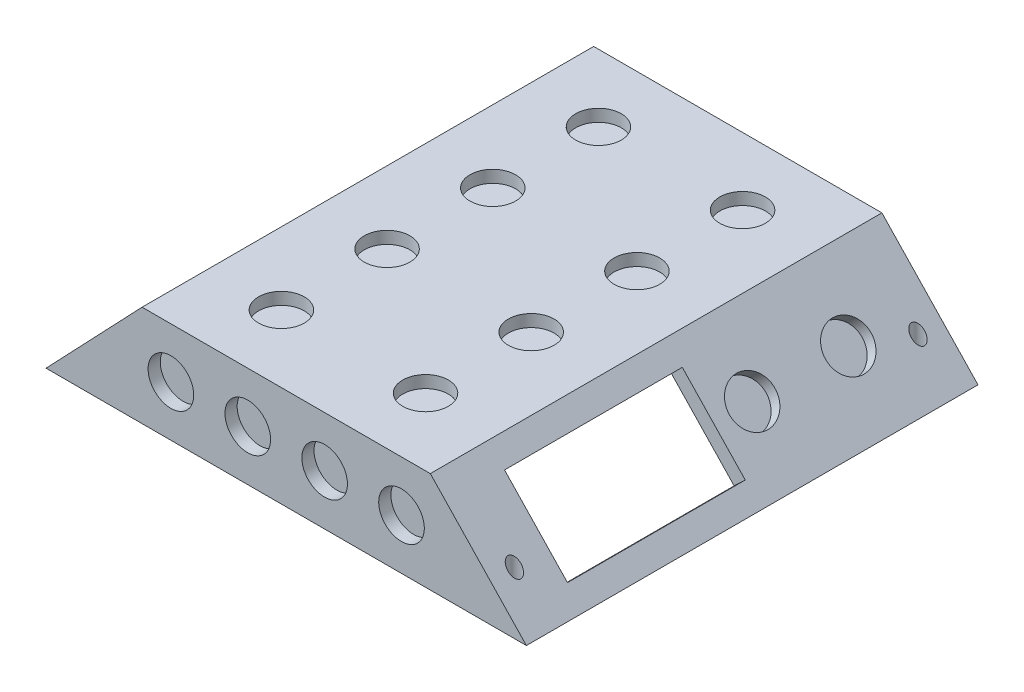
from build123d import *

# Parameters (mm, degrees)
SALIENTE_EXTRUIR1_DEPTH        = 94
CORTAR_EXTRUIR1_DEPTH          = 91
TALADRO_DE_MARGEN_PARA_M2_51_D = 2.7
CORTAR_EXTRUIR2_REACH          = 125.567
CROQUIS12_W                    = 37
CROQUIS12_H                    = 19
CROQUIS13_R                    = 4.75
CORTAR_EXTRUIR3_DEPTH          = 2.54
CROQUIS14_R                    = 4.75
CORTAR_EXTRUIR4_DEPTH          = 2.54
CROQUIS15_R                    = 4.75
CORTAR_EXTRUIR5_DEPTH          = 2.54
CROQUIS17_R                    = 4.75
CORTAR_EXTRUIR7_DEPTH          = 2.54


with BuildPart() as part:
    # Croquis2 → Saliente-Extruir1 (new body)
    with BuildSketch(Plane.XY):
        Polygon((-30, 21), (-50, 0), (50, 0), (30, 21), align=None)
    extrude(amount=SALIENTE_EXTRUIR1_DEPTH)

    # Croquis3 → Cortar-Extruir1 (cut)
    with BuildSketch(Plane(origin=(0, 0, 0), x_dir=(-1, 0, 0), z_dir=(0, 0, -1))):
        Polygon((-28.628571429, 17.8), (-45.580952381, 0), (45.580952381, 0), (28.628571429, 17.8), align=None)
    extrude(amount=-CORTAR_EXTRUIR1_DEPTH, mode=Mode.SUBTRACT)

    # Taladro de margen para M2.51 (through all)
    with Locations(Plane(origin=(0, 21, 0), x_dir=(1, 0, 0), z_dir=(0, 1, 0))):
        with Locations((-42.5, -5), (42.5, -5), (-42.5, -89), (42.5, -89)):
            Hole(TALADRO_DE_MARGEN_PARA_M2_51_D / 2)

    # Croquis12 → Cortar-Extruir2 (cut, up to next)
    with BuildSketch(Plane(origin=(26.218787158, 24.970273484, 0), x_dir=(0, 0, -1), z_dir=(0.7241379310344828, 0.6896551724137933, 0)), mode=Mode.PRIVATE) as cortar_extruir2_sk1:
        with Locations((-63.5, -19.982758621)):
            Rectangle(CROQUIS12_W, CROQUIS12_H)
    cortar_extruir2_tool1 = extrude(cortar_extruir2_sk1.sketch, amount=-CORTAR_EXTRUIR2_REACH, mode=Mode.PRIVATE) & part.part
    add(cortar_extruir2_tool1.solids().sort_by_distance((40, 10.5, 63.5))[0], mode=Mode.SUBTRACT)

    # Croquis13 → Cortar-Extruir3 (cut)
    with BuildSketch(Plane(origin=(0, 21, 0), x_dir=(1, 0, 0), z_dir=(0, 1, 0))):
        with Locations((-15, -14)):
            Circle(CROQUIS13_R)
        with Locations((-15, -36)):
            Circle(CROQUIS13_R)
        with Locations((-15, -58)):
            Circle(CROQUIS13_R)
        with Locations((-15, -80)):
            Circle(CROQUIS13_R)
        with Locations((15, -14)):
            Circle(CROQUIS13_R)
        with Locations((15, -36)):
            Circle(CROQUIS13_R)
        with Locations((15, -58)):
            Circle(CROQUIS13_R)
        with Locations((15, -80)):
            Circle(CROQUIS13_R)
    extrude(amount=-CORTAR_EXTRUIR3_DEPTH, mode=Mode.SUBTRACT)

    # Croquis14 → Cortar-Extruir4 (cut)
    with BuildSketch(Plane(origin=(-26.218787158, 24.970273484, 0), x_dir=(0, 0, 1), z_dir=(-0.7241379310344828, 0.6896551724137933, 0))):
        with Locations((17, -19.982758621)):
            Circle(CROQUIS14_R)
        with Locations((37, -19.982758621)):
            Circle(CROQUIS14_R)
        with Locations((57, -19.982758621)):
            Circle(CROQUIS14_R)
        with Locations((77, -19.982758621)):
            Circle(CROQUIS14_R)
    extrude(amount=-CORTAR_EXTRUIR4_DEPTH, mode=Mode.SUBTRACT)

    # Croquis15 → Cortar-Extruir5 (cut)
    with BuildSketch(Plane(origin=(26.218787158, 24.970273484, 0), x_dir=(0, 0, -1), z_dir=(0.7241379310344828, 0.6896551724137933, 0))):
        with Locations((-17, -19.982758621)):
            Circle(CROQUIS15_R)
        with Locations((-37, -19.982758621)):
            Circle(CROQUIS15_R)
    extrude(amount=-CORTAR_EXTRUIR5_DEPTH, mode=Mode.SUBTRACT)

    # Croquis17 → Cortar-Extruir7 (cut)
    with BuildSketch(Plane.XY.offset(94)):
        with Locations((-8, 10.5)):
            Circle(CROQUIS17_R)
        with Locations((8, 10.5)):
            Circle(CROQUIS17_R)
        with Locations((-24, 10.5)):
            Circle(CROQUIS17_R)
        with Locations((24, 10.5)):
            Circle(CROQUIS17_R)
    extrude(amount=-CORTAR_EXTRUIR7_DEPTH, mode=Mode.SUBTRACT)


solid = part.part
